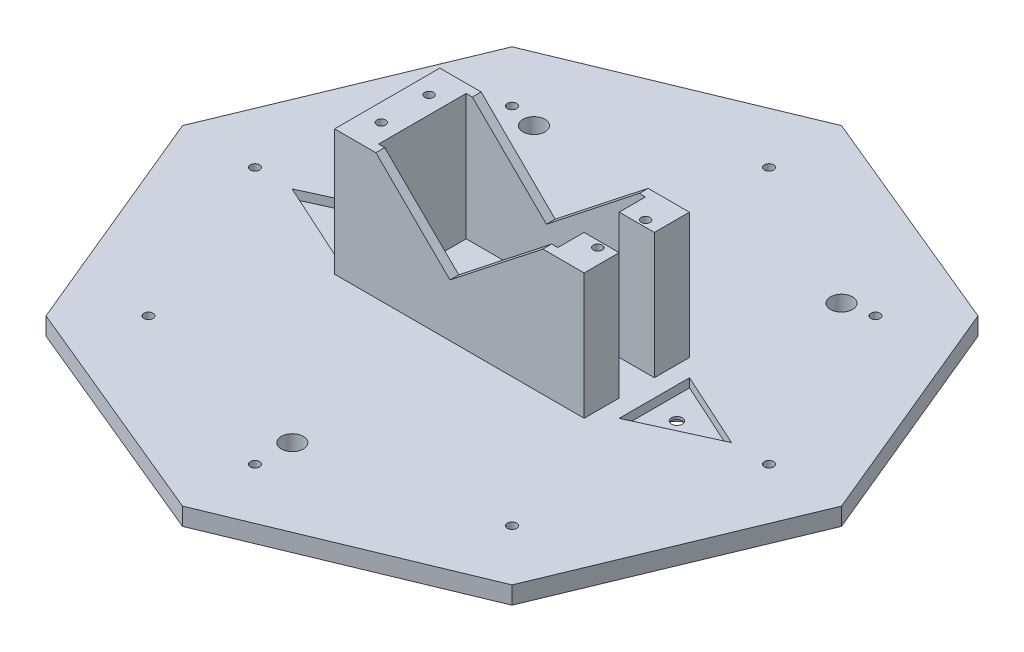
from build123d import *

# Parameters (mm, degrees)
AUFSATZ_LINEAR_AUSTRAGEN1_DEPTH      = 3
AUFSATZ_LINEAR_AUSTRAGEN1_DEPTH_BACK = 1
AUFSATZ_LINEAR_AUSTRAGEN3_DEPTH      = 31.65
SCHNITT_LINEAR_AUSTRAGEN1_DEPTH      = 28.65
SKIZZE7_R                            = 2.5
SCHNITT_LINEAR_AUSTRAGEN2_DEPTH      = 110.867294952
SCHNITT_LINEAR_AUSTRAGEN6_DEPTH      = 2
SKIZZE9_R                            = 1
SCHNITT_LINEAR_AUSTRAGEN5_DEPTH      = 13.1
SKIZZE10_R                           = 1.25
SCHNITT_LINEAR_AUSTRAGEN7_DEPTH      = 111.405717696
SKIZZE11_R                           = 2.75
SCHNITT_LINEAR_AUSTRAGEN8_DEPTH      = 1.4
SKIZZE14_R                           = 1.05
SCHNITT_LINEAR_AUSTRAGEN9_DEPTH      = 10


with BuildPart() as part:
    # Skizze2 → Aufsatz-Linear austragen1 (new, two sides: drawn at the far end of the back side and taken through both)
    with BuildSketch(Plane(origin=(0, 0, 0), x_dir=(1, 0, 0), z_dir=(0, 1, 0)).offset(-AUFSATZ_LINEAR_AUSTRAGEN1_DEPTH_BACK)):
        Polygon((-53.033008589, 53.033008589), (-75, 0), (-53.033008589, -53.033008589), (0, -75), (53.033008589, -53.033008589), (75, 0), (53.033008589, 53.033008589), (0, 75), align=None)
    extrude(amount=AUFSATZ_LINEAR_AUSTRAGEN1_DEPTH + AUFSATZ_LINEAR_AUSTRAGEN1_DEPTH_BACK)

    # Skizze5 → Aufsatz-Linear austragen3 (add)
    with BuildSketch(Plane(origin=(0, 0, 0), x_dir=(1, 0, 0), z_dir=(0, 1, 0))):
        Polygon((20.4, -4), (28.4, -4), (28.4, -11.975), (-28.4, -11.975), (-28.4, 11.975), (28.4, 11.975), (28.4, 4), (20.4, 4), (20.4, 9.975), (-20.4, 9.975), (-20.4, -9.975), (20.4, -9.975), align=None)
    extrude(amount=AUFSATZ_LINEAR_AUSTRAGEN3_DEPTH)

    # Skizze6 → Schnitt-Linear austragen1 (cut)
    with BuildSketch(Plane.XY.offset(11.975)):
        Polygon((-19, 31.65), (19, 31.65), (-2.152730863, 14.994542406), align=None)
    extrude(amount=-SCHNITT_LINEAR_AUSTRAGEN1_DEPTH, mode=Mode.SUBTRACT)

    # Skizze7 → Schnitt-Linear austragen2 (cut, through all)
    with BuildSketch(Plane(origin=(0, 3, 0), x_dir=(1, 0, 0), z_dir=(0, 1, 0))):
        with Locations((35, 40)):
            Circle(SKIZZE7_R)
        with Locations((-35, 40)):
            Circle(SKIZZE7_R)
        with Locations((0, -50)):
            Circle(SKIZZE7_R)
    extrude(amount=-SCHNITT_LINEAR_AUSTRAGEN2_DEPTH, mode=Mode.SUBTRACT)

    # Skizze8 → Schnitt-Linear austragen6 (cut)
    with BuildSketch(Plane(origin=(0, 3, 0), x_dir=(1, 0, 0), z_dir=(0, 1, 0))):
        Polygon((-32.4, -8.05), (-32.4, 8.05), (-50.075644699, 0), align=None)
        Polygon((49.9752149, 0), (32.4, 8.004261364), (32.4, -8.004261364), align=None)
    extrude(amount=-SCHNITT_LINEAR_AUSTRAGEN6_DEPTH, mode=Mode.SUBTRACT)

    # Skizze9 → Schnitt-Linear austragen5 (cut)
    with BuildSketch(Plane(origin=(0, 31.65, 0), x_dir=(1, 0, 0), z_dir=(0, 1, 0))):
        with Locations((-24.35, -5.425)):
            Circle(SKIZZE9_R)
        with Locations((-24.35, 5.475)):
            Circle(SKIZZE9_R)
        with Locations((24.95, 5.475)):
            Circle(SKIZZE9_R)
        with Locations((24.95, -5.425)):
            Circle(SKIZZE9_R)
    extrude(amount=-SCHNITT_LINEAR_AUSTRAGEN5_DEPTH, mode=Mode.SUBTRACT)

    # Skizze10 → Schnitt-Linear austragen7 (cut, through all)
    with BuildSketch(Plane(origin=(0, 1, 0), x_dir=(1, 0, 0), z_dir=(0, 1, 0))):
        with Locations((-37.487800905, 0)):
            Circle(SKIZZE10_R)
        with Locations((37.49, 0.05)):
            Circle(SKIZZE10_R)
    extrude(amount=-SCHNITT_LINEAR_AUSTRAGEN7_DEPTH, mode=Mode.SUBTRACT)

    # Skizze11 → Schnitt-Linear austragen8 (cut)
    with BuildSketch(Plane.XZ.offset(1)):
        with Locations((-37.487800905, 0)):
            Circle(SKIZZE11_R)
        with Locations((37.49, -0.05)):
            Circle(SKIZZE11_R)
    extrude(amount=-SCHNITT_LINEAR_AUSTRAGEN8_DEPTH, mode=Mode.SUBTRACT)

    # Skizze14 → Schnitt-Linear austragen9 (cut)
    with BuildSketch(Plane(origin=(0, 3, 0), x_dir=(1, 0, 0), z_dir=(0, 1, 0))):
        with Locations((-58.5, 0)):
            Circle(SKIZZE14_R)
        with Locations((0, 58.5)):
            Circle(SKIZZE14_R)
        with Locations((-41.365746699, 41.365746699)):
            Circle(SKIZZE14_R)
        with Locations((41.365746699, 41.365746699)):
            Circle(SKIZZE14_R)
        with Locations((58.5, 0)):
            Circle(SKIZZE14_R)
        with Locations((41.365746699, -41.365746699)):
            Circle(SKIZZE14_R)
        with Locations((-41.365746699, -41.365746699)):
            Circle(SKIZZE14_R)
        with Locations((0, -58.5)):
            Circle(SKIZZE14_R)
    extrude(amount=-SCHNITT_LINEAR_AUSTRAGEN9_DEPTH, mode=Mode.SUBTRACT)


solid = part.part
